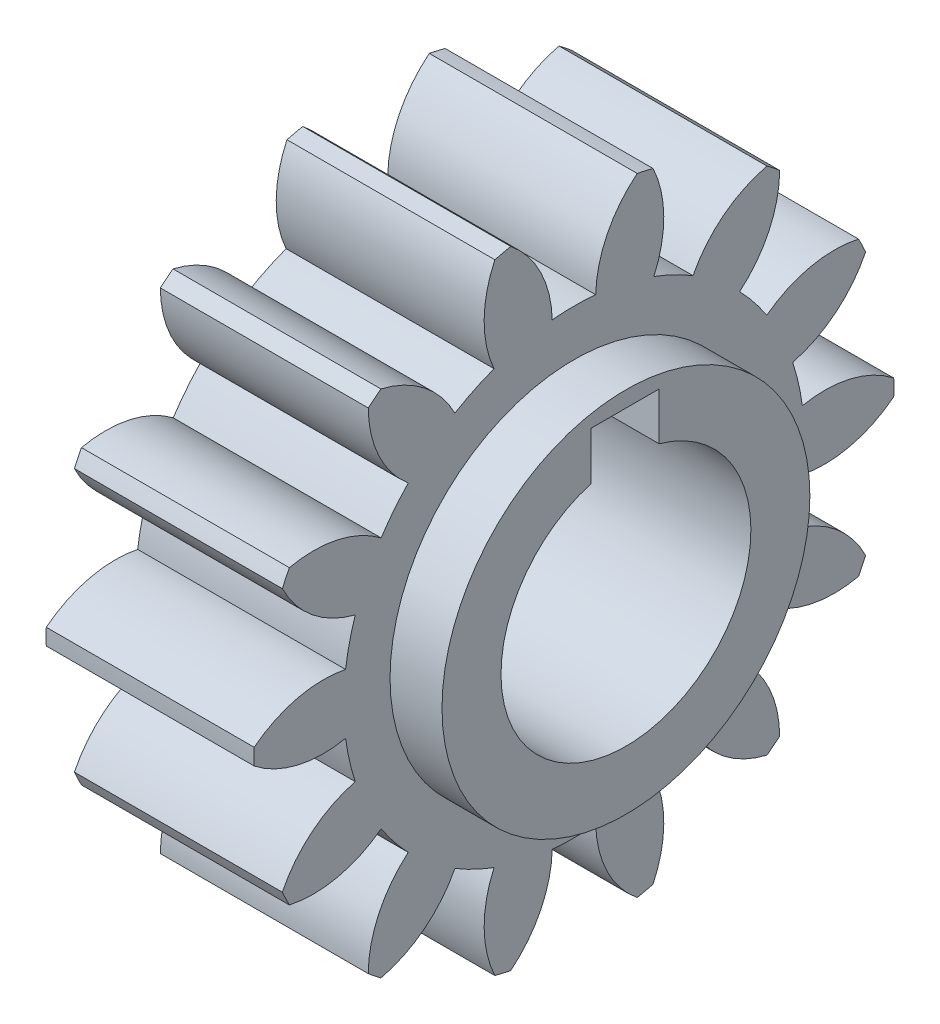
from build123d import *

# Parameters (mm, degrees)
BASPROSKE_W         = 6.604
BASPROSKE_H         = 10.16
TOOTHCUT_DEPTH      = 16.813412535
TEETHCUTS_COUNT     = 14
TEETHCUTS_ANGLE     = 334.285714286
BORSKE_R            = 3.96875
BORE_DEPTH          = 50.8000508
BOSS_EXTRUDE1_START = 1.651
SKETCH1_R           = 5.842
SKETCH1_R_2         = 3.96875
BOSS_EXTRUDE1_DEPTH = 1.651
SKETCH2_W           = 2.159
SKETCH2_H           = 5.334
CUT_EXTRUDE1_DEPTH  = 17.448750705


with BuildPart() as part:
    # BasProSke → Base-Revolve (revolve)
    with BuildSketch(Plane(origin=(0, 0, 0), x_dir=(1, 0, 0), z_dir=(0, 1, 0))):
        with Locations((3.302, 5.08)):
            Rectangle(BASPROSKE_W, BASPROSKE_H)
    revolve(axis=Axis((-10, 0, 0), (1, 0, 0)))

    # TooCutSke → ToothCut (cut, through all)
    with BuildSketch(Plane(origin=(0, 0, 0), x_dir=(0, 0, -1), z_dir=(1, 0, 0))):
        with BuildLine():
            ThreePointArc((0.690270933, 7.282559789), (0, 7.3152), (-0.690270933, 7.282559789))
            ThreePointArc((-0.690270933, 7.282559789), (-1.062455419, 8.780807329), (-2.034499207, 9.980139585))
            ThreePointArc((-2.034499207, 9.980139585), (0, 10.1854), (2.034499207, 9.980139585))
            ThreePointArc((2.034499207, 9.980139585), (1.062455419, 8.780807329), (0.690270933, 7.282559789))
        make_face()
    toothcut = extrude(amount=TOOTHCUT_DEPTH, mode=Mode.SUBTRACT)

    # TeethCuts: ToothCut ×14 about axis
    teethcuts_axis = Axis((-10, 0, 0), (1, 0, 0))
    for i in range(1, TEETHCUTS_COUNT):
        add(toothcut.rotate(teethcuts_axis, i * TEETHCUTS_ANGLE / (TEETHCUTS_COUNT - 1)), mode=Mode.SUBTRACT)

    # BorSke → Bore (cut, symmetric)
    with BuildSketch(Plane(origin=(0, 0, 0), x_dir=(0, 0, -1), z_dir=(1, 0, 0))):
        Circle(BORSKE_R)
    extrude(amount=BORE_DEPTH, both=True, mode=Mode.SUBTRACT)

    # Sketch1 → Boss-Extrude1 (add)
    with BuildSketch(Plane(origin=(6.604, 0, 0), x_dir=(0, 0, -1), z_dir=(1, 0, 0)).offset(BOSS_EXTRUDE1_START)):
        Circle(SKETCH1_R)
        Circle(SKETCH1_R_2, mode=Mode.SUBTRACT)
    extrude(amount=-BOSS_EXTRUDE1_DEPTH)

    # Sketch2 → Cut-Extrude1 (cut, through all)
    with BuildSketch(Plane.ZY):
        with Locations((0.026405968, 2.667)):
            Rectangle(SKETCH2_W, SKETCH2_H)
    extrude(amount=-CUT_EXTRUDE1_DEPTH, mode=Mode.SUBTRACT)


solid = part.part
